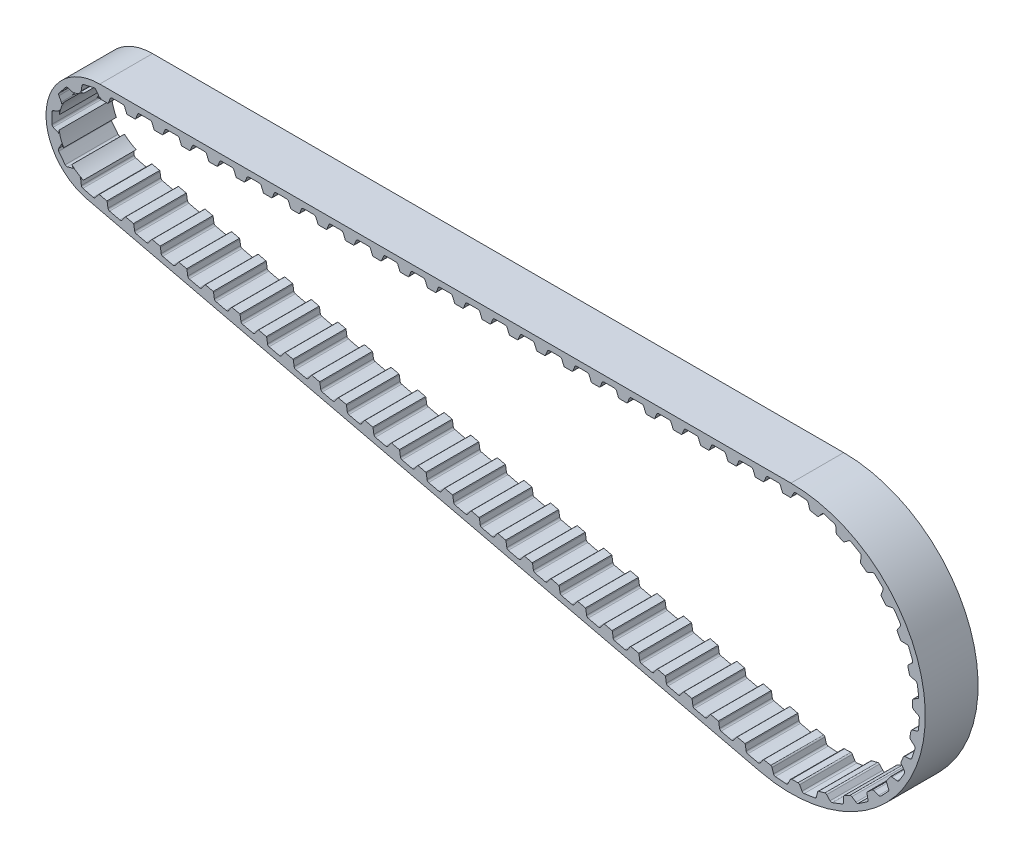
from build123d import *

# Parameters (mm, degrees)
SKETCH1_R           = 54.170022186
SKETCH1_R_2         = 51.884022186
BOSS_EXTRUDE1_DEPTH = 4.7625
CUT_EXTRUDE1_DEPTH  = 4.7625
CIRPATTERN1_COUNT   = 67
BOSS_EXTRUDE2_DEPTH = 4.7625
LPATTERN1_COUNT     = 2
LPATTERN1_PITCH     = 54.229
CRVPATTERN1_START   = -4.7625
CRVPATTERN1_DEPTH   = 9.525


with BuildPart() as part:
    # Sketch1 → Boss-Extrude1 (new, symmetric)
    with BuildSketch(Plane.XY):
        with Locations(Location((0, 0, 0), (0, 0, 180))):
            Circle(SKETCH1_R)
        with Locations(Location((0, 0, 0), (0, 0, 180))):
            Circle(SKETCH1_R_2, mode=Mode.SUBTRACT)
    extrude(amount=BOSS_EXTRUDE1_DEPTH, both=True)

    # Sketch3 → Cut-Extrude1 (cut, symmetric)
    with BuildSketch(Plane.XY):
        with BuildLine():
            Line((-1.980161212, 51.846221847), (1.980161212, 51.846221847))
            ThreePointArc((1.980161212, 51.846221847), (1.776513355, 51.914606858), (1.642231134, 52.082288831))
            Line((1.642231134, 52.082288831), (1.302897103, 52.909118486))
            ThreePointArc((1.302897103, 52.909118486), (1.1654549, 53.0789843), (0.957287799, 53.145401256))
            ThreePointArc((0.957287799, 53.145401256), (0, 53.154022186), (-0.957287799, 53.145401256))
            ThreePointArc((-0.957287799, 53.145401256), (-1.1654549, 53.0789843), (-1.302897103, 52.909118486))
            Line((-1.302897103, 52.909118486), (-1.642231134, 52.082288831))
            ThreePointArc((-1.642231134, 52.082288831), (-1.776513355, 51.914606858), (-1.980161212, 51.846221847))
        make_face()
    cut_extrude1 = extrude(amount=CUT_EXTRUDE1_DEPTH, both=True, mode=Mode.SUBTRACT)

    # CirPattern1: Cut-Extrude1 ×67 about axis
    cirpattern1_axis = Axis((0, 0, 0), (0, 0, 1))
    for i in range(1, CIRPATTERN1_COUNT):
        add(cut_extrude1.rotate(cirpattern1_axis, i * 360 / CIRPATTERN1_COUNT), mode=Mode.SUBTRACT)


with BuildPart() as body_2:
    # Sketch4 → Boss-Extrude2 (new, symmetric)
    with BuildSketch(Plane.XY):
        with BuildLine():
            Line((-62.357, 0), (62.357, 0))
            ThreePointArc((62.357, 0), (86.443630382, -27.060113316), (56.774636225, -47.848722734))
            Line((56.774636225, -47.848722734), (-64.58994551, -19.139489094))
            ThreePointArc((-64.58994551, -19.139489094), (-71.991652153, -8.575954674), (-62.357, 0))
        make_face()
        with BuildLine():
            Line((-62.357, -2.286), (62.357, -2.286))
            ThreePointArc((62.357, -2.286), (84.173030916, -26.795209438), (57.300874724, -45.624117366))
            Line((57.300874724, -45.624117366), (-64.063707011, -16.914883726))
            ThreePointArc((-64.063707011, -16.914883726), (-69.721052687, -8.840858552), (-62.357, -2.286))
        make_face(mode=Mode.SUBTRACT)
    extrude(amount=BOSS_EXTRUDE2_DEPTH, both=True)

    # LPattern1: Cut-Extrude1 ×2
    with Locations(*[(0, -i * LPATTERN1_PITCH, 0) for i in range(1, LPATTERN1_COUNT)]):
        add(cut_extrude1, mode=Mode.SUBTRACT)

    # CrvPattern1: read off the stored shape, not the designer's step
    # CrvPattern1 outline → CrvPattern1 (cut)
    with BuildSketch(Plane.XY.offset(CRVPATTERN1_START)):
        with BuildLine():
            Line((3.189359063, -2.286), (6.670682023, -2.286))
            ThreePointArc((6.670682023, -2.286), (6.613572486, -2.221934244), (6.572251676, -2.146711169))
            Line((6.572251676, -2.146711169), (6.232917645, -1.319881514))
            ThreePointArc((6.232917645, -1.319881514), (6.095475442, -1.1500157), (5.887308341, -1.083598744))
            ThreePointArc((5.887308341, -1.083598744), (4.930020542, -1.074977814), (3.972732744, -1.083598744))
            ThreePointArc((3.972732744, -1.083598744), (3.764565643, -1.1500157), (3.62712344, -1.319881514))
            Line((3.62712344, -1.319881514), (3.287789409, -2.146711169))
            ThreePointArc((3.287789409, -2.146711169), (3.2464686, -2.221934244), (3.189359063, -2.286))
        make_face()
        with BuildLine():
            Line((8.119379606, -2.286), (11.600702565, -2.286))
            ThreePointArc((11.600702565, -2.286), (11.543593029, -2.221934244), (11.502272219, -2.146711169))
            Line((11.502272219, -2.146711169), (11.162938188, -1.319881514))
            ThreePointArc((11.162938188, -1.319881514), (11.025495985, -1.1500157), (10.817328884, -1.083598744))
            ThreePointArc((10.817328884, -1.083598744), (9.860041085, -1.074977814), (8.902753287, -1.083598744))
            ThreePointArc((8.902753287, -1.083598744), (8.694586186, -1.1500157), (8.557143983, -1.319881514))
            Line((8.557143983, -1.319881514), (8.217809952, -2.146711169))
            ThreePointArc((8.217809952, -2.146711169), (8.176489142, -2.221934244), (8.119379606, -2.286))
        make_face()
        with BuildLine():
            Line((13.049400148, -2.286), (16.530723108, -2.286))
            ThreePointArc((16.530723108, -2.286), (16.473613571, -2.221934244), (16.432292762, -2.146711169))
            Line((16.432292762, -2.146711169), (16.092958731, -1.319881514))
            ThreePointArc((16.092958731, -1.319881514), (15.955516528, -1.1500157), (15.747349427, -1.083598744))
            ThreePointArc((15.747349427, -1.083598744), (14.790061629, -1.074977814), (13.83277383, -1.083598744))
            ThreePointArc((13.83277383, -1.083598744), (13.624606729, -1.1500157), (13.487164526, -1.319881514))
            Line((13.487164526, -1.319881514), (13.147830495, -2.146711169))
            ThreePointArc((13.147830495, -2.146711169), (13.106509685, -2.221934244), (13.049400148, -2.286))
        make_face()
        with BuildLine():
            Line((17.979420691, -2.286), (21.460743651, -2.286))
            ThreePointArc((21.460743651, -2.286), (21.403634114, -2.221934244), (21.362313305, -2.146711169))
            Line((21.362313305, -2.146711169), (21.022979274, -1.319881514))
            ThreePointArc((21.022979274, -1.319881514), (20.885537071, -1.1500157), (20.67736997, -1.083598744))
            ThreePointArc((20.67736997, -1.083598744), (19.720082171, -1.074977814), (18.762794372, -1.083598744))
            ThreePointArc((18.762794372, -1.083598744), (18.554627271, -1.1500157), (18.417185068, -1.319881514))
            Line((18.417185068, -1.319881514), (18.077851037, -2.146711169))
            ThreePointArc((18.077851037, -2.146711169), (18.036530228, -2.221934244), (17.979420691, -2.286))
        make_face()
        with BuildLine():
            Line((22.909441234, -2.286), (26.390764194, -2.286))
            ThreePointArc((26.390764194, -2.286), (26.333654657, -2.221934244), (26.292333847, -2.146711169))
            Line((26.292333847, -2.146711169), (25.952999816, -1.319881514))
            ThreePointArc((25.952999816, -1.319881514), (25.815557613, -1.1500157), (25.607390512, -1.083598744))
            ThreePointArc((25.607390512, -1.083598744), (24.650102713, -1.074977814), (23.692814915, -1.083598744))
            ThreePointArc((23.692814915, -1.083598744), (23.484647814, -1.1500157), (23.347205611, -1.319881514))
            Line((23.347205611, -1.319881514), (23.00787158, -2.146711169))
            ThreePointArc((23.00787158, -2.146711169), (22.966550771, -2.221934244), (22.909441234, -2.286))
        make_face()
        with BuildLine():
            Line((27.839461777, -2.286), (31.320784737, -2.286))
            ThreePointArc((31.320784737, -2.286), (31.2636752, -2.221934244), (31.22235439, -2.146711169))
            Line((31.22235439, -2.146711169), (30.883020359, -1.319881514))
            ThreePointArc((30.883020359, -1.319881514), (30.745578156, -1.1500157), (30.537411055, -1.083598744))
            ThreePointArc((30.537411055, -1.083598744), (29.580123256, -1.074977814), (28.622835458, -1.083598744))
            ThreePointArc((28.622835458, -1.083598744), (28.414668357, -1.1500157), (28.277226154, -1.319881514))
            Line((28.277226154, -1.319881514), (27.937892123, -2.146711169))
            ThreePointArc((27.937892123, -2.146711169), (27.896571313, -2.221934244), (27.839461777, -2.286))
        make_face()
        with BuildLine():
            Line((32.769482319, -2.286), (36.250805279, -2.286))
            ThreePointArc((36.250805279, -2.286), (36.193695742, -2.221934244), (36.152374933, -2.146711169))
            Line((36.152374933, -2.146711169), (35.813040902, -1.319881514))
            ThreePointArc((35.813040902, -1.319881514), (35.675598699, -1.1500157), (35.467431598, -1.083598744))
            ThreePointArc((35.467431598, -1.083598744), (34.510143799, -1.074977814), (33.552856001, -1.083598744))
            ThreePointArc((33.552856001, -1.083598744), (33.3446889, -1.1500157), (33.207246697, -1.319881514))
            Line((33.207246697, -1.319881514), (32.867912666, -2.146711169))
            ThreePointArc((32.867912666, -2.146711169), (32.826591856, -2.221934244), (32.769482319, -2.286))
        make_face()
        with BuildLine():
            Line((37.699502862, -2.286), (41.180825822, -2.286))
            ThreePointArc((41.180825822, -2.286), (41.123716285, -2.221934244), (41.082395476, -2.146711169))
            Line((41.082395476, -2.146711169), (40.743061445, -1.319881514))
            ThreePointArc((40.743061445, -1.319881514), (40.605619242, -1.1500157), (40.397452141, -1.083598744))
            ThreePointArc((40.397452141, -1.083598744), (39.440164342, -1.074977814), (38.482876543, -1.083598744))
            ThreePointArc((38.482876543, -1.083598744), (38.274709442, -1.1500157), (38.137267239, -1.319881514))
            Line((38.137267239, -1.319881514), (37.797933208, -2.146711169))
            ThreePointArc((37.797933208, -2.146711169), (37.756612399, -2.221934244), (37.699502862, -2.286))
        make_face()
        with BuildLine():
            Line((42.629523405, -2.286), (46.110846365, -2.286))
            ThreePointArc((46.110846365, -2.286), (46.053736828, -2.221934244), (46.012416019, -2.146711169))
            Line((46.012416019, -2.146711169), (45.673081987, -1.319881514))
            ThreePointArc((45.673081987, -1.319881514), (45.535639784, -1.1500157), (45.327472683, -1.083598744))
            ThreePointArc((45.327472683, -1.083598744), (44.370184884, -1.074977814), (43.412897086, -1.083598744))
            ThreePointArc((43.412897086, -1.083598744), (43.204729985, -1.1500157), (43.067287782, -1.319881514))
            Line((43.067287782, -1.319881514), (42.727953751, -2.146711169))
            ThreePointArc((42.727953751, -2.146711169), (42.686632942, -2.221934244), (42.629523405, -2.286))
        make_face()
        with BuildLine():
            Line((47.559543948, -2.286), (51.040866908, -2.286))
            ThreePointArc((51.040866908, -2.286), (50.983757371, -2.221934244), (50.942436561, -2.146711169))
            Line((50.942436561, -2.146711169), (50.60310253, -1.319881514))
            ThreePointArc((50.60310253, -1.319881514), (50.465660327, -1.1500157), (50.257493226, -1.083598744))
            ThreePointArc((50.257493226, -1.083598744), (49.300205427, -1.074977814), (48.342917629, -1.083598744))
            ThreePointArc((48.342917629, -1.083598744), (48.134750528, -1.1500157), (47.997308325, -1.319881514))
            Line((47.997308325, -1.319881514), (47.657974294, -2.146711169))
            ThreePointArc((47.657974294, -2.146711169), (47.616653484, -2.221934244), (47.559543948, -2.286))
        make_face()
        with BuildLine():
            Line((52.48956449, -2.286), (55.97088745, -2.286))
            ThreePointArc((55.97088745, -2.286), (55.913777913, -2.221934244), (55.872457104, -2.146711169))
            Line((55.872457104, -2.146711169), (55.533123073, -1.319881514))
            ThreePointArc((55.533123073, -1.319881514), (55.39568087, -1.1500157), (55.187513769, -1.083598744))
            ThreePointArc((55.187513769, -1.083598744), (54.230225971, -1.074977814), (53.272938172, -1.083598744))
            ThreePointArc((53.272938172, -1.083598744), (53.064771071, -1.1500157), (52.927328868, -1.319881514))
            Line((52.927328868, -1.319881514), (52.587994837, -2.146711169))
            ThreePointArc((52.587994837, -2.146711169), (52.546674027, -2.221934244), (52.48956449, -2.286))
        make_face()
        with BuildLine():
            Line((57.419585033, -2.286), (60.900907993, -2.286))
            ThreePointArc((60.900907993, -2.286), (60.843798456, -2.221934244), (60.802477647, -2.146711169))
            Line((60.802477647, -2.146711169), (60.463143616, -1.319881514))
            ThreePointArc((60.463143616, -1.319881514), (60.325701413, -1.1500157), (60.117534312, -1.083598744))
            ThreePointArc((60.117534312, -1.083598744), (59.160246513, -1.074977814), (58.202958715, -1.083598744))
            ThreePointArc((58.202958715, -1.083598744), (57.994791613, -1.1500157), (57.85734941, -1.319881514))
            Line((57.85734941, -1.319881514), (57.518015379, -2.146711169))
            ThreePointArc((57.518015379, -2.146711169), (57.47669457, -2.221934244), (57.419585033, -2.286))
        make_face()
        with BuildLine():
            ThreePointArc((62.357, -2.286), (64.165517573, -2.360583375), (65.961752744, -2.583826973))
            ThreePointArc((65.961752744, -2.583826973), (65.822115264, -2.489889515), (65.736569442, -2.344959242))
            Line((65.736569442, -2.344959242), (65.463472184, -1.493952338))
            ThreePointArc((65.463472184, -1.493952338), (65.339848596, -1.313780302), (65.13756512, -1.231159788))
            ThreePointArc((65.13756512, -1.231159788), (64.183936097, -1.147100662), (63.228947862, -1.080229738))
            ThreePointArc((63.228947862, -1.080229738), (63.016192807, -1.130029744), (62.865787455, -1.28853206))
            Line((62.865787455, -1.28853206), (62.46232873, -2.086038123))
            ThreePointArc((62.46232873, -2.086038123), (62.356075269, -2.214941012), (62.204892025, -2.286))
            Line((62.204892025, -2.286), (62.357, -2.286))
        make_face()
        with BuildLine():
            ThreePointArc((67.094885014, -2.803094825), (68.918547345, -3.289003066), (70.693763538, -3.929673484))
            ThreePointArc((70.693763538, -3.929673484), (70.57853743, -3.807012097), (70.527396007, -3.646676741))
            Line((70.527396007, -3.646676741), (70.450565846, -2.756231914))
            ThreePointArc((70.450565846, -2.756231914), (70.370145931, -2.553063532), (70.19132641, -2.42749151))
            ThreePointArc((70.19132641, -2.42749151), (69.280329325, -2.133283146), (68.36418139, -1.85552928))
            ThreePointArc((68.36418139, -1.85552928), (68.145678933, -1.856725206), (67.963767251, -1.977774345))
            Line((67.963767251, -1.977774345), (67.392921252, -2.665473195))
            ThreePointArc((67.392921252, -2.665473195), (67.25948536, -2.768029201), (67.094885014, -2.803094825))
        make_face()
        with BuildLine():
            ThreePointArc((71.749666329, -4.395652485), (73.419428402, -5.275280665), (75.007512801, -6.295005657))
            ThreePointArc((75.007512801, -6.295005657), (74.922479044, -6.149774352), (74.908307822, -5.982078054))
            Line((74.908307822, -5.982078054), (75.031599383, -5.096869574))
            ThreePointArc((75.031599383, -5.096869574), (74.998417867, -4.880897953), (74.852033807, -4.718674463))
            ThreePointArc((74.852033807, -4.718674463), (74.029374051, -4.22907751), (73.198030228, -3.754375817))
            ThreePointArc((73.198030228, -3.754375817), (72.984742797, -3.706907662), (72.780451428, -3.7844305))
            Line((72.780451428, -3.7844305), (72.070857918, -4.327819783))
            ThreePointArc((72.070857918, -4.327819783), (71.91794249, -4.398103093), (71.749666329, -4.395652485))
        make_face()
        with BuildLine():
            ThreePointArc((75.933210696, -6.984317299), (77.365299327, -8.213533826), (78.686576574, -9.561153043))
            ThreePointArc((78.686576574, -9.561153043), (78.636001372, -9.400638182), (78.659511332, -9.233994389))
            Line((78.659511332, -9.233994389), (78.976738988, -8.398433812))
            ThreePointArc((78.976738988, -8.398433812), (78.992460612, -8.180494406), (78.885856208, -7.989758319))
            ThreePointArc((78.885856208, -7.989758319), (78.192807224, -7.329336216), (77.487976642, -6.681502826))
            ThreePointArc((77.487976642, -6.681502826), (77.290605023, -6.587752102), (77.074183414, -6.617859262))
            Line((77.074183414, -6.617859262), (76.261443218, -6.98967674))
            ThreePointArc((76.261443218, -6.98967674), (76.096720134, -7.024161189), (75.933210696, -6.984317299))
        make_face()
        with BuildLine():
            ThreePointArc((79.435626631, -10.439214056), (80.558192883, -11.956348238), (81.546373532, -13.564250637))
            ThreePointArc((81.546373532, -13.564250637), (81.532794282, -13.396505366), (81.592805911, -13.23927472))
            Line((81.592805911, -13.23927472), (82.088054118, -12.495282733))
            ThreePointArc((82.088054118, -12.495282733), (82.151890117, -12.286309722), (82.090413791, -12.076630407))
            ThreePointArc((82.090413791, -12.076630407), (81.561746352, -11.278517014), (81.018790878, -10.490054204))
            ThreePointArc((81.018790878, -10.490054204), (80.84723735, -10.354724454), (80.629543532, -10.335905437))
            Line((80.629543532, -10.335905437), (79.754432421, -10.517496754))
            ThreePointArc((79.754432421, -10.517496754), (79.586165958, -10.514452231), (79.435626631, -10.439214056))
        make_face()
        with BuildLine():
            ThreePointArc((82.081195363, -14.587008057), (82.837919266, -16.315944161), (83.443425569, -18.103460101))
            ThreePointArc((83.443425569, -18.103460101), (83.467523551, -17.936900325), (83.561026023, -17.796971202))
            Line((83.561026023, -17.796971202), (84.209447816, -17.181874427))
            ThreePointArc((84.209447816, -17.181874427), (84.31819549, -16.99235214), (84.304931553, -16.774249362))
            ThreePointArc((84.304931553, -16.774249362), (83.967169294, -15.878486611), (83.6133294, -14.988952138))
            ThreePointArc((83.6133294, -14.988952138), (83.47620093, -14.818832954), (83.268156761, -14.752031924))
            Line((83.268156761, -14.752031924), (82.3745797, -14.734286512))
            ThreePointArc((82.3745797, -14.734286512), (82.21121191, -14.693865764), (82.081195363, -14.587008057))
        make_face()
        with BuildLine():
            ThreePointArc((83.73718677, -19.21960144), (84.090102931, -21.073597476), (84.282556195, -22.951045973))
            ThreePointArc((84.282556195, -22.951045973), (84.343122395, -22.794028117), (84.465424622, -22.678420863))
            Line((84.465424622, -22.678420863), (85.234488204, -22.223079157))
            ThreePointArc((85.234488204, -22.223079157), (85.382691604, -22.062516066), (85.418305519, -21.8469322))
            ThreePointArc((85.418305519, -21.8469322), (85.288394218, -20.898461165), (85.141422312, -19.952483624))
            ThreePointArc((85.141422312, -19.952483624), (85.045598735, -19.75611001), (84.857641943, -19.644678425))
            Line((84.857641943, -19.644678425), (83.990430348, -19.428486583))
            ThreePointArc((83.990430348, -19.428486583), (83.840157512, -19.352717548), (83.73718677, -19.21960144))
        make_face()
        with BuildLine():
            ThreePointArc((84.320518552, -24.104573602), (84.251920909, -25.990613231), (84.021665611, -27.863801319))
            ThreePointArc((84.021665611, -27.863801319), (84.11566138, -27.724203084), (84.260627369, -27.6387178))
            Line((84.260627369, -27.6387178), (85.111748258, -27.365975989))
            ThreePointArc((85.111748258, -27.365975989), (85.291971909, -27.242427661), (85.374676899, -27.040178709))
            ThreePointArc((85.374676899, -27.040178709), (85.459134302, -26.086584877), (85.526404072, -25.131624654))
            ThreePointArc((85.526404072, -25.131624654), (85.476692927, -24.918848819), (85.318253442, -24.768377281))
            Line((85.318253442, -24.768377281), (84.520915954, -24.364585512))
            ThreePointArc((84.520915954, -24.364585512), (84.391277371, -24.257269579), (84.320518552, -24.104573602))
        make_face()
        with BuildLine():
            ThreePointArc((83.801924525, -28.996841913), (83.315254671, -30.820301145), (82.67384289, -32.595249607))
            ThreePointArc((82.67384289, -32.595249607), (82.79655239, -32.480074739), (82.956909092, -32.429000284))
            Line((82.956909092, -32.429000284), (83.847385929, -32.352542025))
            ThreePointArc((83.847385929, -32.352542025), (84.05058788, -32.27220697), (84.176234576, -32.09343991))
            ThreePointArc((84.176234576, -32.09343991), (84.470823392, -31.182565781), (84.748959864, -30.266533929))
            ThreePointArc((84.748959864, -30.266533929), (84.747855196, -30.048030992), (84.626882043, -29.86606877))
            Line((84.626882043, -29.86606877), (83.939421667, -29.294935603))
            ThreePointArc((83.939421667, -29.294935603), (83.836921399, -29.16145689), (83.801924525, -28.996841913))
        make_face()
        with BuildLine():
            ThreePointArc((82.207422931, -33.650957689), (81.327097451, -35.32035224), (80.306709283, -36.908010612))
            ThreePointArc((80.306709283, -36.908010612), (80.451976089, -36.823037517), (80.619678291, -36.808936335))
            Line((80.619678291, -36.808936335), (81.504835202, -36.932597594))
            ThreePointArc((81.504835202, -36.932597594), (81.720820662, -36.899506281), (81.883105276, -36.753189986))
            ThreePointArc((81.883105276, -36.753189986), (82.37304577, -35.930734783), (82.848094633, -35.099589292))
            ThreePointArc((82.848094633, -35.099589292), (82.895651864, -34.886321705), (82.818214355, -34.681997976))
            Line((82.818214355, -34.681997976), (82.275121481, -33.97217758))
            ThreePointArc((82.275121481, -33.97217758), (82.204902043, -33.819232811), (82.207422931, -33.650957689))
        make_face()
        with BuildLine():
            ThreePointArc((79.617011083, -37.833420534), (78.38719655, -39.264995657), (77.039025619, -40.585709955))
            ThreePointArc((77.039025619, -40.585709955), (77.199561589, -40.535201797), (77.366195548, -40.558781353))
            Line((77.366195548, -40.558781353), (78.201623562, -40.876357954))
            ThreePointArc((78.201623562, -40.876357954), (78.419556382, -40.892170599), (78.610336976, -40.785645866))
            ThreePointArc((78.610336976, -40.785645866), (79.271048475, -40.092872768), (79.91917618, -39.388312815))
            ThreePointArc((79.91917618, -39.388312815), (80.013009328, -39.190980369), (79.98299256, -38.974546204))
            Line((79.98299256, -38.974546204), (79.611514556, -38.161650789))
            ThreePointArc((79.611514556, -38.161650789), (79.577098907, -37.996913317), (79.617011083, -37.833420534))
        make_face()
        with BuildLine():
            ThreePointArc((76.160651841, -41.334393225), (74.64304895, -42.456325747), (73.034733978, -43.443834768))
            ThreePointArc((73.034733978, -43.443834768), (73.202484905, -43.430325578), (73.359690474, -43.490402869))
            Line((73.359690474, -43.490402869), (74.103475555, -43.985961762))
            ThreePointArc((74.103475555, -43.985961762), (74.312421886, -44.049885032), (74.522126859, -43.988496284))
            ThreePointArc((74.522126859, -43.988496284), (75.320460982, -43.460162225), (76.109150488, -42.917536099))
            ThreePointArc((76.109150488, -42.917536099), (76.244551876, -42.746039108), (76.263461811, -42.528353168))
            Line((76.263461811, -42.528353168), (76.082236001, -41.653166292))
            ThreePointArc((76.082236001, -41.653166292), (76.0853508, -41.484901115), (76.160651841, -41.334393225))
        make_face()
        with BuildLine():
            ThreePointArc((72.011753278, -43.978229397), (70.282501278, -44.734231142), (68.494732605, -45.338990836))
            ThreePointArc((68.494732605, -45.338990836), (68.661282302, -45.36315838), (68.801172362, -45.456719285))
            Line((68.801172362, -45.456719285), (69.415998269, -46.105397916))
            ThreePointArc((69.415998269, -46.105397916), (69.605475121, -46.214224735), (69.82358342, -46.201051891))
            ThreePointArc((69.82358342, -46.201051891), (70.719487159, -45.863663776), (71.609169337, -45.510195428))
            ThreePointArc((71.609169337, -45.510195428), (71.779345777, -45.37313802), (71.846233691, -45.165121769))
            Line((71.846233691, -45.165121769), (71.864352305, -44.271552197))
            ThreePointArc((71.864352305, -44.271552197), (71.90484128, -44.108201303), (72.011753278, -43.978229397))
        make_face()
        with BuildLine():
            ThreePointArc((67.378468674, -45.632285854), (65.524325404, -45.984427661), (63.646796693, -46.176096791))
            ThreePointArc((63.646796693, -46.176096791), (63.80378924, -46.236728565), (63.919345404, -46.359079065))
            Line((63.919345404, -46.359079065), (64.37436587, -47.128332754))
            ThreePointArc((64.37436587, -47.128332754), (64.534867051, -47.276603199), (64.750436023, -47.31230715))
            ThreePointArc((64.750436023, -47.31230715), (65.698961232, -47.18279199), (66.645000074, -47.036215185))
            ThreePointArc((66.645000074, -47.036215185), (66.841413691, -46.940473632), (66.952923767, -46.752563395))
            Line((66.952923767, -46.752563395), (67.169477782, -45.885442169))
            ThreePointArc((67.169477782, -45.885442169), (67.245309572, -45.735200991), (67.378468674, -45.632285854))
        make_face()
        with BuildLine():
            ThreePointArc((62.493253309, -46.213577373), (60.607242495, -46.14419203), (58.734150736, -45.913154415))
            ThreePointArc((58.734150736, -45.913154415), (58.873709701, -46.007208479), (58.959134433, -46.152210159))
            Line((58.959134433, -46.152210159), (59.231520749, -47.003444884))
            ThreePointArc((59.231520749, -47.003444884), (59.354993796, -47.18372012), (59.557208188, -47.266509572))
            ThreePointArc((59.557208188, -47.266509572), (60.510766663, -47.351365237), (61.465698708, -47.41903384))
            ThreePointArc((61.465698708, -47.41903384), (61.678495287, -47.369411566), (61.829032983, -47.211034939))
            Line((61.829032983, -47.211034939), (62.233157725, -46.413866164))
            ThreePointArc((62.233157725, -46.413866164), (62.340527793, -46.284272413), (62.493253309, -46.213577373))
        make_face()
        with BuildLine():
            Line((57.300874724, -45.624117366), (54.069635753, -44.859756025))
            ThreePointArc((54.069635753, -44.859756025), (54.110463538, -44.935247828), (54.133358208, -45.017962726))
            Line((54.133358208, -45.017962726), (54.273242159, -45.900701273))
            ThreePointArc((54.273242159, -45.900701273), (54.367889898, -46.097644309), (54.555177077, -46.210197703))
            ThreePointArc((54.555177077, -46.210197703), (55.484770651, -46.438955298), (56.418333311, -46.650934093))
            ThreePointArc((56.418333311, -46.650934093), (56.636198932, -46.634221069), (56.809053084, -46.500556579))
            Line((56.809053084, -46.500556579), (57.329610347, -45.774047805))
            ThreePointArc((57.329610347, -45.774047805), (57.387472485, -45.710061891), (57.458246293, -45.660733479))
            ThreePointArc((57.458246293, -45.660733479), (57.379526838, -45.642570133), (57.300874724, -45.624117366))
        make_face()
        with BuildLine():
            Line((52.659845544, -44.526265018), (49.272019759, -43.724862495))
            ThreePointArc((49.272019759, -43.724862495), (49.312847543, -43.800354298), (49.335742214, -43.883069196))
            Line((49.335742214, -43.883069196), (49.475626164, -44.765807744))
            ThreePointArc((49.475626164, -44.765807744), (49.570273903, -44.96275078), (49.757561082, -45.075304174))
            ThreePointArc((49.757561082, -45.075304174), (50.687154656, -45.304061769), (51.620717316, -45.516040564))
            ThreePointArc((51.620717316, -45.516040564), (51.838582937, -45.49932754), (52.01143709, -45.36566305))
            Line((52.01143709, -45.36566305), (52.531994353, -44.639154276))
            ThreePointArc((52.531994353, -44.639154276), (52.589521813, -44.575463525), (52.659845544, -44.526265018))
        make_face()
        with BuildLine():
            Line((47.86222955, -43.391371489), (44.474403765, -42.589968966))
            ThreePointArc((44.474403765, -42.589968966), (44.515231549, -42.665460769), (44.538126219, -42.748175667))
            Line((44.538126219, -42.748175667), (44.67801017, -43.630914215))
            ThreePointArc((44.67801017, -43.630914215), (44.772657909, -43.827857251), (44.959945088, -43.940410645))
            ThreePointArc((44.959945088, -43.940410645), (45.889538662, -44.16916824), (46.823101322, -44.381147035))
            ThreePointArc((46.823101322, -44.381147035), (47.040966943, -44.36443401), (47.213821096, -44.230769521))
            Line((47.213821096, -44.230769521), (47.734378359, -43.504260747))
            ThreePointArc((47.734378359, -43.504260747), (47.791905818, -43.440569996), (47.86222955, -43.391371489))
        make_face()
        with BuildLine():
            Line((43.064613555, -42.256477959), (39.67678777, -41.455075437))
            ThreePointArc((39.67678777, -41.455075437), (39.717615555, -41.53056724), (39.740510225, -41.613282138))
            Line((39.740510225, -41.613282138), (39.880394176, -42.496020685))
            ThreePointArc((39.880394176, -42.496020685), (39.975041915, -42.692963721), (40.162329094, -42.805517115))
            ThreePointArc((40.162329094, -42.805517115), (41.091922668, -43.03427471), (42.025485328, -43.246253505))
            ThreePointArc((42.025485328, -43.246253505), (42.243350949, -43.229540481), (42.416205101, -43.095875991))
            Line((42.416205101, -43.095875991), (42.936762364, -42.369367217))
            ThreePointArc((42.936762364, -42.369367217), (42.994289824, -42.305676467), (43.064613555, -42.256477959))
        make_face()
        with BuildLine():
            Line((38.266997561, -41.12158443), (34.879171776, -40.320181907))
            ThreePointArc((34.879171776, -40.320181907), (34.91999956, -40.39567371), (34.942894231, -40.478388608))
            Line((34.942894231, -40.478388608), (35.082778181, -41.361127156))
            ThreePointArc((35.082778181, -41.361127156), (35.17742592, -41.558070192), (35.364713099, -41.670623586))
            ThreePointArc((35.364713099, -41.670623586), (36.294306673, -41.899381181), (37.227869333, -42.111359976))
            ThreePointArc((37.227869333, -42.111359976), (37.445734954, -42.094646952), (37.618589107, -41.960982462))
            Line((37.618589107, -41.960982462), (38.13914637, -41.234473688))
            ThreePointArc((38.13914637, -41.234473688), (38.19667383, -41.170782937), (38.266997561, -41.12158443))
        make_face()
        with BuildLine():
            Line((33.469381567, -39.986690901), (30.081555782, -39.185288378))
            ThreePointArc((30.081555782, -39.185288378), (30.122383566, -39.260780181), (30.145278236, -39.343495079))
            Line((30.145278236, -39.343495079), (30.285162187, -40.226233627))
            ThreePointArc((30.285162187, -40.226233627), (30.379809926, -40.423176663), (30.567097105, -40.535730057))
            ThreePointArc((30.567097105, -40.535730057), (31.496690679, -40.764487652), (32.430253339, -40.976466447))
            ThreePointArc((32.430253339, -40.976466447), (32.64811896, -40.959753423), (32.820973113, -40.826088933))
            Line((32.820973113, -40.826088933), (33.341530376, -40.099580159))
            ThreePointArc((33.341530376, -40.099580159), (33.399057835, -40.035889408), (33.469381567, -39.986690901))
        make_face()
        with BuildLine():
            Line((28.671765572, -38.851797371), (25.283939787, -38.050394849))
            ThreePointArc((25.283939787, -38.050394849), (25.324767572, -38.125886652), (25.347662242, -38.20860155))
            Line((25.347662242, -38.20860155), (25.487546193, -39.091340097))
            ThreePointArc((25.487546193, -39.091340097), (25.582193932, -39.288283133), (25.769481111, -39.400836528))
            ThreePointArc((25.769481111, -39.400836528), (26.699074685, -39.629594122), (27.632637345, -39.841572917))
            ThreePointArc((27.632637345, -39.841572917), (27.850502965, -39.824859893), (28.023357118, -39.691195404))
            Line((28.023357118, -39.691195404), (28.543914381, -38.964686629))
            ThreePointArc((28.543914381, -38.964686629), (28.601441841, -38.900995879), (28.671765572, -38.851797371))
        make_face()
        with BuildLine():
            Line((23.874149578, -37.716903842), (20.486323793, -36.915501319))
            ThreePointArc((20.486323793, -36.915501319), (20.527151577, -36.990993122), (20.550046248, -37.07370802))
            Line((20.550046248, -37.07370802), (20.689930198, -37.956446568))
            ThreePointArc((20.689930198, -37.956446568), (20.784577937, -38.153389604), (20.971865116, -38.265942998))
            ThreePointArc((20.971865116, -38.265942998), (21.90145869, -38.494700593), (22.83502135, -38.706679388))
            ThreePointArc((22.83502135, -38.706679388), (23.052886971, -38.689966364), (23.225741124, -38.556301874))
            Line((23.225741124, -38.556301874), (23.746298387, -37.8297931))
            ThreePointArc((23.746298387, -37.8297931), (23.803825847, -37.766102349), (23.874149578, -37.716903842))
        make_face()
        with BuildLine():
            Line((19.076533583, -36.582010313), (15.688707799, -35.78060779))
            ThreePointArc((15.688707799, -35.78060779), (15.729535583, -35.856099593), (15.752430253, -35.938814491))
            Line((15.752430253, -35.938814491), (15.892314204, -36.821553039))
            ThreePointArc((15.892314204, -36.821553039), (15.986961943, -37.018496075), (16.174249122, -37.131049469))
            ThreePointArc((16.174249122, -37.131049469), (17.103842696, -37.359807064), (18.037405356, -37.571785859))
            ThreePointArc((18.037405356, -37.571785859), (18.255270977, -37.555072835), (18.42812513, -37.421408345))
            Line((18.42812513, -37.421408345), (18.948682393, -36.694899571))
            ThreePointArc((18.948682393, -36.694899571), (19.006209852, -36.63120882), (19.076533583, -36.582010313))
        make_face()
        with BuildLine():
            Line((14.278917589, -35.447116784), (10.891091804, -34.645714261))
            ThreePointArc((10.891091804, -34.645714261), (10.931919589, -34.721206064), (10.954814259, -34.803920962))
            Line((10.954814259, -34.803920962), (11.09469821, -35.686659509))
            ThreePointArc((11.09469821, -35.686659509), (11.189345949, -35.883602545), (11.376633128, -35.99615594))
            ThreePointArc((11.376633128, -35.99615594), (12.306226702, -36.224913534), (13.239789362, -36.43689233))
            ThreePointArc((13.239789362, -36.43689233), (13.457654982, -36.420179305), (13.630509135, -36.286514816))
            Line((13.630509135, -36.286514816), (14.151066398, -35.560006041))
            ThreePointArc((14.151066398, -35.560006041), (14.208593858, -35.496315291), (14.278917589, -35.447116784))
        make_face()
        with BuildLine():
            Line((9.481301595, -34.312223254), (6.09347581, -33.510820731))
            ThreePointArc((6.09347581, -33.510820731), (6.134303594, -33.586312534), (6.157198265, -33.669027432))
            Line((6.157198265, -33.669027432), (6.297082215, -34.55176598))
            ThreePointArc((6.297082215, -34.55176598), (6.391729954, -34.748709016), (6.579017133, -34.86126241))
            ThreePointArc((6.579017133, -34.86126241), (7.508610707, -35.090020005), (8.442173367, -35.3019988))
            ThreePointArc((8.442173367, -35.3019988), (8.660038988, -35.285285776), (8.832893141, -35.151621286))
            Line((8.832893141, -35.151621286), (9.353450404, -34.425112512))
            ThreePointArc((9.353450404, -34.425112512), (9.410977864, -34.361421762), (9.481301595, -34.312223254))
        make_face()
        with BuildLine():
            Line((4.6836856, -33.177329725), (1.295859816, -32.375927202))
            ThreePointArc((1.295859816, -32.375927202), (1.3366876, -32.451419005), (1.35958227, -32.534133903))
            Line((1.35958227, -32.534133903), (1.499466221, -33.416872451))
            ThreePointArc((1.499466221, -33.416872451), (1.59411396, -33.613815487), (1.781401139, -33.726368881))
            ThreePointArc((1.781401139, -33.726368881), (2.710994713, -33.955126476), (3.644557373, -34.167105271))
            ThreePointArc((3.644557373, -34.167105271), (3.862422994, -34.150392247), (4.035277147, -34.016727757))
            Line((4.035277147, -34.016727757), (4.55583441, -33.290218983))
            ThreePointArc((4.55583441, -33.290218983), (4.613361869, -33.226528232), (4.6836856, -33.177329725))
        make_face()
        with BuildLine():
            Line((-0.113930394, -32.042436196), (-3.501756179, -31.241033673))
            ThreePointArc((-3.501756179, -31.241033673), (-3.460928394, -31.316525476), (-3.438033724, -31.399240374))
            Line((-3.438033724, -31.399240374), (-3.298149773, -32.281978921))
            ThreePointArc((-3.298149773, -32.281978921), (-3.203502034, -32.478921958), (-3.016214855, -32.591475352))
            ThreePointArc((-3.016214855, -32.591475352), (-2.086621281, -32.820232946), (-1.153058621, -33.032211742))
            ThreePointArc((-1.153058621, -33.032211742), (-0.935193001, -33.015498717), (-0.762338848, -32.881834228))
            Line((-0.762338848, -32.881834228), (-0.241781585, -32.155325453))
            ThreePointArc((-0.241781585, -32.155325453), (-0.184254125, -32.091634703), (-0.113930394, -32.042436196))
        make_face()
        with BuildLine():
            Line((-4.911546388, -30.907542666), (-8.299372173, -30.106140143))
            ThreePointArc((-8.299372173, -30.106140143), (-8.258544389, -30.181631947), (-8.235649718, -30.264346845))
            Line((-8.235649718, -30.264346845), (-8.095765768, -31.147085392))
            ThreePointArc((-8.095765768, -31.147085392), (-8.001118029, -31.344028428), (-7.81383085, -31.456581822))
            ThreePointArc((-7.81383085, -31.456581822), (-6.884237276, -31.685339417), (-5.950674616, -31.897318212))
            ThreePointArc((-5.950674616, -31.897318212), (-5.732808995, -31.880605188), (-5.559954842, -31.746940698))
            Line((-5.559954842, -31.746940698), (-5.039397579, -31.020431924))
            ThreePointArc((-5.039397579, -31.020431924), (-4.981870119, -30.956741174), (-4.911546388, -30.907542666))
        make_face()
        with BuildLine():
            Line((-9.709162383, -29.772649137), (-13.096988167, -28.971246614))
            ThreePointArc((-13.096988167, -28.971246614), (-13.056160383, -29.046738417), (-13.033265713, -29.129453315))
            Line((-13.033265713, -29.129453315), (-12.893381762, -30.012191863))
            ThreePointArc((-12.893381762, -30.012191863), (-12.798734023, -30.209134899), (-12.611446844, -30.321688293))
            ThreePointArc((-12.611446844, -30.321688293), (-11.68185327, -30.550445888), (-10.74829061, -30.762424683))
            ThreePointArc((-10.74829061, -30.762424683), (-10.530424989, -30.745711659), (-10.357570836, -30.612047169))
            Line((-10.357570836, -30.612047169), (-9.837013573, -29.885538395))
            ThreePointArc((-9.837013573, -29.885538395), (-9.779486114, -29.821847644), (-9.709162383, -29.772649137))
        make_face()
        with BuildLine():
            Line((-14.506778377, -28.637755608), (-17.894604162, -27.836353085))
            ThreePointArc((-17.894604162, -27.836353085), (-17.853776377, -27.911844888), (-17.830881707, -27.994559786))
            Line((-17.830881707, -27.994559786), (-17.690997756, -28.877298334))
            ThreePointArc((-17.690997756, -28.877298334), (-17.596350017, -29.07424137), (-17.409062838, -29.186794764))
            ThreePointArc((-17.409062838, -29.186794764), (-16.479469264, -29.415552359), (-15.545906604, -29.627531154))
            ThreePointArc((-15.545906604, -29.627531154), (-15.328040984, -29.610818129), (-15.155186831, -29.47715364))
            Line((-15.155186831, -29.47715364), (-14.634629568, -28.750644866))
            ThreePointArc((-14.634629568, -28.750644866), (-14.577102108, -28.686954115), (-14.506778377, -28.637755608))
        make_face()
        with BuildLine():
            Line((-19.304394371, -27.502862078), (-22.692220156, -26.701459556))
            ThreePointArc((-22.692220156, -26.701459556), (-22.651392372, -26.776951359), (-22.628497701, -26.859666257))
            Line((-22.628497701, -26.859666257), (-22.488613751, -27.742404804))
            ThreePointArc((-22.488613751, -27.742404804), (-22.393966012, -27.93934784), (-22.206678833, -28.051901234))
            ThreePointArc((-22.206678833, -28.051901234), (-21.277085259, -28.280658829), (-20.343522599, -28.492637624))
            ThreePointArc((-20.343522599, -28.492637624), (-20.125656978, -28.4759246), (-19.952802825, -28.34226011))
            Line((-19.952802825, -28.34226011), (-19.432245562, -27.615751336))
            ThreePointArc((-19.432245562, -27.615751336), (-19.374718102, -27.552060586), (-19.304394371, -27.502862078))
        make_face()
        with BuildLine():
            Line((-24.102010366, -26.367968549), (-27.48983615, -25.566566026))
            ThreePointArc((-27.48983615, -25.566566026), (-27.449008366, -25.642057829), (-27.426113696, -25.724772727))
            Line((-27.426113696, -25.724772727), (-27.286229745, -26.607511275))
            ThreePointArc((-27.286229745, -26.607511275), (-27.191582006, -26.804454311), (-27.004294827, -26.917007705))
            ThreePointArc((-27.004294827, -26.917007705), (-26.074701253, -27.1457653), (-25.141138593, -27.357744095))
            ThreePointArc((-25.141138593, -27.357744095), (-24.923272972, -27.341031071), (-24.750418819, -27.207366581))
            Line((-24.750418819, -27.207366581), (-24.229861556, -26.480857807))
            ThreePointArc((-24.229861556, -26.480857807), (-24.172334097, -26.417167056), (-24.102010366, -26.367968549))
        make_face()
        with BuildLine():
            Line((-28.89962636, -25.23307502), (-32.287452145, -24.431672497))
            ThreePointArc((-32.287452145, -24.431672497), (-32.24662436, -24.5071643), (-32.22372969, -24.589879198))
            Line((-32.22372969, -24.589879198), (-32.083845739, -25.472617746))
            ThreePointArc((-32.083845739, -25.472617746), (-31.989198, -25.669560782), (-31.801910821, -25.782114176))
            ThreePointArc((-31.801910821, -25.782114176), (-30.872317247, -26.010871771), (-29.938754587, -26.222850566))
            ThreePointArc((-29.938754587, -26.222850566), (-29.720888967, -26.206137541), (-29.548034814, -26.072473052))
            Line((-29.548034814, -26.072473052), (-29.027477551, -25.345964278))
            ThreePointArc((-29.027477551, -25.345964278), (-28.969950091, -25.282273527), (-28.89962636, -25.23307502))
        make_face()
        with BuildLine():
            Line((-33.697242354, -24.09818149), (-37.085068139, -23.296778968))
            ThreePointArc((-37.085068139, -23.296778968), (-37.044240355, -23.372270771), (-37.021345684, -23.454985669))
            Line((-37.021345684, -23.454985669), (-36.881461734, -24.337724216))
            ThreePointArc((-36.881461734, -24.337724216), (-36.786813995, -24.534667252), (-36.599526816, -24.647220646))
            ThreePointArc((-36.599526816, -24.647220646), (-35.669933242, -24.875978241), (-34.736370582, -25.087957036))
            ThreePointArc((-34.736370582, -25.087957036), (-34.518504961, -25.071244012), (-34.345650808, -24.937579522))
            Line((-34.345650808, -24.937579522), (-33.825093545, -24.211070748))
            ThreePointArc((-33.825093545, -24.211070748), (-33.767566085, -24.147379998), (-33.697242354, -24.09818149))
        make_face()
        with BuildLine():
            Line((-38.494858349, -22.963287961), (-41.882684133, -22.161885438))
            ThreePointArc((-41.882684133, -22.161885438), (-41.841856349, -22.237377241), (-41.818961679, -22.320092139))
            Line((-41.818961679, -22.320092139), (-41.679077728, -23.202830687))
            ThreePointArc((-41.679077728, -23.202830687), (-41.584429989, -23.399773723), (-41.39714281, -23.512327117))
            ThreePointArc((-41.39714281, -23.512327117), (-40.467549236, -23.741084712), (-39.533986576, -23.953063507))
            ThreePointArc((-39.533986576, -23.953063507), (-39.316120955, -23.936350483), (-39.143266802, -23.802685993))
            Line((-39.143266802, -23.802685993), (-38.622709539, -23.076177219))
            ThreePointArc((-38.622709539, -23.076177219), (-38.56518208, -23.012486468), (-38.494858349, -22.963287961))
        make_face()
        with BuildLine():
            Line((-43.292474343, -21.828394432), (-46.680300128, -21.026991909))
            ThreePointArc((-46.680300128, -21.026991909), (-46.639472343, -21.102483712), (-46.616577673, -21.18519861))
            Line((-46.616577673, -21.18519861), (-46.476693722, -22.067937158))
            ThreePointArc((-46.476693722, -22.067937158), (-46.382045983, -22.264880194), (-46.194758804, -22.377433588))
            ThreePointArc((-46.194758804, -22.377433588), (-45.26516523, -22.606191183), (-44.33160257, -22.818169978))
            ThreePointArc((-44.33160257, -22.818169978), (-44.113736949, -22.801456954), (-43.940882797, -22.667792464))
            Line((-43.940882797, -22.667792464), (-43.420325534, -21.94128369))
            ThreePointArc((-43.420325534, -21.94128369), (-43.362798074, -21.877592939), (-43.292474343, -21.828394432))
        make_face()
        with BuildLine():
            Line((-48.090090337, -20.693500903), (-51.477916122, -19.89209838))
            ThreePointArc((-51.477916122, -19.89209838), (-51.437088338, -19.967590183), (-51.414193667, -20.050305081))
            Line((-51.414193667, -20.050305081), (-51.274309717, -20.933043628))
            ThreePointArc((-51.274309717, -20.933043628), (-51.179661978, -21.129986664), (-50.992374799, -21.242540059))
            ThreePointArc((-50.992374799, -21.242540059), (-50.062781225, -21.471297653), (-49.129218565, -21.683276449))
            ThreePointArc((-49.129218565, -21.683276449), (-48.911352944, -21.666563424), (-48.738498791, -21.532898935))
            Line((-48.738498791, -21.532898935), (-48.217941528, -20.80639016))
            ThreePointArc((-48.217941528, -20.80639016), (-48.160414068, -20.74269941), (-48.090090337, -20.693500903))
        make_face()
        with BuildLine():
            Line((-52.887706332, -19.558607373), (-56.275532116, -18.75720485))
            ThreePointArc((-56.275532116, -18.75720485), (-56.234704332, -18.832696653), (-56.211809662, -18.915411551))
            Line((-56.211809662, -18.915411551), (-56.071925711, -19.798150099))
            ThreePointArc((-56.071925711, -19.798150099), (-55.977277972, -19.995093135), (-55.789990793, -20.107646529))
            ThreePointArc((-55.789990793, -20.107646529), (-54.860397219, -20.336404124), (-53.926834559, -20.548382919))
            ThreePointArc((-53.926834559, -20.548382919), (-53.708968938, -20.531669895), (-53.536114785, -20.398005405))
            Line((-53.536114785, -20.398005405), (-53.015557522, -19.671496631))
            ThreePointArc((-53.015557522, -19.671496631), (-52.958030063, -19.60780588), (-52.887706332, -19.558607373))
        make_face()
        with BuildLine():
            Line((-57.685322326, -18.423713844), (-61.073148111, -17.622311321))
            ThreePointArc((-61.073148111, -17.622311321), (-61.032320326, -17.697803124), (-61.009425656, -17.780518022))
            Line((-61.009425656, -17.780518022), (-60.869541705, -18.66325657))
            ThreePointArc((-60.869541705, -18.66325657), (-60.774893966, -18.860199606), (-60.587606787, -18.972753))
            ThreePointArc((-60.587606787, -18.972753), (-59.658013213, -19.201510595), (-58.724450553, -19.41348939))
            ThreePointArc((-58.724450553, -19.41348939), (-58.506584932, -19.396776366), (-58.33373078, -19.263111876))
            Line((-58.33373078, -19.263111876), (-57.813173517, -18.536603102))
            ThreePointArc((-57.813173517, -18.536603102), (-57.755646057, -18.472912351), (-57.685322326, -18.423713844))
        make_face()
        with BuildLine():
            ThreePointArc((-64.063707011, -16.914883726), (-64.696240292, -16.735293232), (-65.310374064, -16.500365993))
            Line((-65.310374064, -16.500365993), (-66.072479572, -16.307418976))
            ThreePointArc((-66.072479572, -16.307418976), (-65.89184446, -16.423694148), (-65.802824048, -16.619204571))
            Line((-65.802824048, -16.619204571), (-65.676799884, -17.504028154))
            ThreePointArc((-65.676799884, -17.504028154), (-65.585252128, -17.702431184), (-65.399752974, -17.817907666))
            ThreePointArc((-65.399752974, -17.817907666), (-64.473860946, -18.061214472), (-63.543737205, -18.287806783))
            ThreePointArc((-63.543737205, -18.287806783), (-63.325636289, -18.274512254), (-63.150707342, -18.143574797))
            Line((-63.150707342, -18.143574797), (-62.618821404, -17.425318428))
            ThreePointArc((-62.618821404, -17.425318428), (-62.543501237, -17.348970647), (-62.449887888, -17.296638515))
            Line((-62.449887888, -17.296638515), (-64.063707011, -16.914883726))
        make_face()
        with BuildLine():
            ThreePointArc((-67.417036674, -15.118802899), (-68.223673459, -14.233159883), (-68.877149785, -13.229170269))
            Line((-68.877149785, -13.229170269), (-69.35782797, -12.607091625))
            ThreePointArc((-69.35782797, -12.607091625), (-69.287423901, -12.810050306), (-69.338005585, -13.018833573))
            Line((-69.338005585, -13.018833573), (-69.784793307, -13.792897907))
            ThreePointArc((-69.784793307, -13.792897907), (-69.835170942, -14.005516928), (-69.760446345, -14.21084834))
            ThreePointArc((-69.760446345, -14.21084834), (-69.181951273, -14.973618097), (-68.589812775, -15.725845621))
            ThreePointArc((-68.589812775, -15.725845621), (-68.409977147, -15.849958074), (-68.191526278, -15.854854166))
            Line((-68.191526278, -15.854854166), (-67.329778907, -15.617817605))
            ThreePointArc((-67.329778907, -15.617817605), (-67.114988219, -15.621548485), (-66.936358489, -15.740881543))
            Line((-66.936358489, -15.740881543), (-67.417036674, -15.118802899))
        make_face()
        with BuildLine():
            ThreePointArc((-69.682505026, -10.842091118), (-69.770813582, -9.647424615), (-69.665570699, -8.454130691))
            Line((-69.665570699, -8.454130691), (-69.659995815, -7.667999482))
            ThreePointArc((-69.659995815, -7.667999482), (-69.729823248, -7.871157275), (-69.898453249, -8.004247026))
            Line((-69.898453249, -8.004247026), (-70.727668456, -8.337709173))
            ThreePointArc((-70.727668456, -8.337709173), (-70.898504652, -8.47394334), (-70.966396127, -8.68163422))
            ThreePointArc((-70.966396127, -8.68163422), (-70.981805318, -9.638836814), (-70.979973082, -10.596161677))
            ThreePointArc((-70.979973082, -10.596161677), (-70.915033986, -10.80479453), (-70.746147096, -10.943437858))
            Line((-70.746147096, -10.943437858), (-69.921744572, -11.288626708))
            ThreePointArc((-69.921744572, -11.288626708), (-69.755019059, -11.424094648), (-69.688079909, -11.628222327))
            Line((-69.688079909, -11.628222327), (-69.682505026, -10.842091118))
        make_face()
        with BuildLine():
            ThreePointArc((-68.826442006, -6.07871347), (-68.158792447, -5.084092678), (-67.339676268, -4.209978761))
            Line((-67.339676268, -4.209978761), (-66.850223874, -3.59477984))
            ThreePointArc((-66.850223874, -3.59477984), (-67.030528065, -3.711567502), (-67.245350064, -3.712251766))
            Line((-67.245350064, -3.712251766), (-68.103649023, -3.46301742))
            ThreePointArc((-68.103649023, -3.46301742), (-68.32214736, -3.464814868), (-68.50372511, -3.586364342))
            ThreePointArc((-68.50372511, -3.586364342), (-69.106472427, -4.330118281), (-69.695727203, -5.084606889))
            ThreePointArc((-69.695727203, -5.084606889), (-69.773356371, -5.288857877), (-69.725999246, -5.502169988))
            Line((-69.725999246, -5.502169988), (-69.29023453, -6.282492982))
            ThreePointArc((-69.29023453, -6.282492982), (-69.242618976, -6.491972618), (-69.3158944, -6.69391239))
            Line((-69.3158944, -6.69391239), (-68.826442006, -6.07871347))
        make_face()
        with BuildLine():
            ThreePointArc((-65.21363169, -2.858432096), (-64.074521676, -2.487683084), (-62.890572553, -2.305225066))
            Line((-62.890572553, -2.305225066), (-62.125807246, -2.12310592))
            ThreePointArc((-62.125807246, -2.12310592), (-62.339757289, -2.103758097), (-62.509231711, -1.971745296))
            Line((-62.509231711, -1.971745296), (-63.030877574, -1.24601776))
            ThreePointArc((-63.030877574, -1.24601776), (-63.203931923, -1.112612564), (-63.421822355, -1.096226184))
            ThreePointArc((-63.421822355, -1.096226184), (-64.355066166, -1.309604341), (-65.284315741, -1.53975533))
            ThreePointArc((-65.284315741, -1.53975533), (-65.471433969, -1.652589379), (-65.565786344, -1.84967409))
            Line((-65.565786344, -1.84967409), (-65.704346733, -2.73262136))
            ThreePointArc((-65.704346733, -2.73262136), (-65.796130994, -2.926849598), (-65.978396997, -3.040551241))
            Line((-65.978396997, -3.040551241), (-65.21363169, -2.858432096))
        make_face()
        with BuildLine():
            Line((-60.900907993, -2.286), (-57.419585033, -2.286))
            ThreePointArc((-57.419585033, -2.286), (-57.47669457, -2.221934244), (-57.518015379, -2.146711169))
            Line((-57.518015379, -2.146711169), (-57.85734941, -1.319881514))
            ThreePointArc((-57.85734941, -1.319881514), (-57.994791613, -1.1500157), (-58.202958715, -1.083598744))
            ThreePointArc((-58.202958715, -1.083598744), (-59.160246513, -1.074977814), (-60.117534312, -1.083598744))
            ThreePointArc((-60.117534312, -1.083598744), (-60.325701413, -1.1500157), (-60.463143616, -1.319881514))
            Line((-60.463143616, -1.319881514), (-60.802477647, -2.146711169))
            ThreePointArc((-60.802477647, -2.146711169), (-60.843798456, -2.221934244), (-60.900907993, -2.286))
        make_face()
        with BuildLine():
            Line((-55.97088745, -2.286), (-52.48956449, -2.286))
            ThreePointArc((-52.48956449, -2.286), (-52.546674027, -2.221934244), (-52.587994837, -2.146711169))
            Line((-52.587994837, -2.146711169), (-52.927328868, -1.319881514))
            ThreePointArc((-52.927328868, -1.319881514), (-53.064771071, -1.1500157), (-53.272938172, -1.083598744))
            ThreePointArc((-53.272938172, -1.083598744), (-54.230225971, -1.074977814), (-55.187513769, -1.083598744))
            ThreePointArc((-55.187513769, -1.083598744), (-55.39568087, -1.1500157), (-55.533123073, -1.319881514))
            Line((-55.533123073, -1.319881514), (-55.872457104, -2.146711169))
            ThreePointArc((-55.872457104, -2.146711169), (-55.913777913, -2.221934244), (-55.97088745, -2.286))
        make_face()
        with BuildLine():
            Line((-51.040866908, -2.286), (-47.559543948, -2.286))
            ThreePointArc((-47.559543948, -2.286), (-47.616653484, -2.221934244), (-47.657974294, -2.146711169))
            Line((-47.657974294, -2.146711169), (-47.997308325, -1.319881514))
            ThreePointArc((-47.997308325, -1.319881514), (-48.134750528, -1.1500157), (-48.342917629, -1.083598744))
            ThreePointArc((-48.342917629, -1.083598744), (-49.300205428, -1.074977814), (-50.257493226, -1.083598744))
            ThreePointArc((-50.257493226, -1.083598744), (-50.465660327, -1.1500157), (-50.60310253, -1.319881514))
            Line((-50.60310253, -1.319881514), (-50.942436561, -2.146711169))
            ThreePointArc((-50.942436561, -2.146711169), (-50.983757371, -2.221934244), (-51.040866908, -2.286))
        make_face()
        with BuildLine():
            Line((-46.110846365, -2.286), (-42.629523405, -2.286))
            ThreePointArc((-42.629523405, -2.286), (-42.686632942, -2.221934244), (-42.727953751, -2.146711169))
            Line((-42.727953751, -2.146711169), (-43.067287782, -1.319881514))
            ThreePointArc((-43.067287782, -1.319881514), (-43.204729985, -1.1500157), (-43.412897086, -1.083598744))
            ThreePointArc((-43.412897086, -1.083598744), (-44.370184885, -1.074977814), (-45.327472683, -1.083598744))
            ThreePointArc((-45.327472683, -1.083598744), (-45.535639784, -1.1500157), (-45.673081987, -1.319881514))
            Line((-45.673081987, -1.319881514), (-46.012416019, -2.146711169))
            ThreePointArc((-46.012416019, -2.146711169), (-46.053736828, -2.221934244), (-46.110846365, -2.286))
        make_face()
        with BuildLine():
            Line((-41.180825822, -2.286), (-37.699502862, -2.286))
            ThreePointArc((-37.699502862, -2.286), (-37.756612399, -2.221934244), (-37.797933208, -2.146711169))
            Line((-37.797933208, -2.146711169), (-38.137267239, -1.319881514))
            ThreePointArc((-38.137267239, -1.319881514), (-38.274709442, -1.1500157), (-38.482876543, -1.083598744))
            ThreePointArc((-38.482876543, -1.083598744), (-39.440164342, -1.074977814), (-40.397452141, -1.083598744))
            ThreePointArc((-40.397452141, -1.083598744), (-40.605619242, -1.1500157), (-40.743061445, -1.319881514))
            Line((-40.743061445, -1.319881514), (-41.082395476, -2.146711169))
            ThreePointArc((-41.082395476, -2.146711169), (-41.123716285, -2.221934244), (-41.180825822, -2.286))
        make_face()
        with BuildLine():
            Line((-36.250805279, -2.286), (-32.769482319, -2.286))
            ThreePointArc((-32.769482319, -2.286), (-32.826591856, -2.221934244), (-32.867912666, -2.146711169))
            Line((-32.867912666, -2.146711169), (-33.207246697, -1.319881514))
            ThreePointArc((-33.207246697, -1.319881514), (-33.3446889, -1.1500157), (-33.552856001, -1.083598744))
            ThreePointArc((-33.552856001, -1.083598744), (-34.510143799, -1.074977814), (-35.467431598, -1.083598744))
            ThreePointArc((-35.467431598, -1.083598744), (-35.675598699, -1.1500157), (-35.813040902, -1.319881514))
            Line((-35.813040902, -1.319881514), (-36.152374933, -2.146711169))
            ThreePointArc((-36.152374933, -2.146711169), (-36.193695742, -2.221934244), (-36.250805279, -2.286))
        make_face()
        with BuildLine():
            Line((-31.320784737, -2.286), (-27.839461777, -2.286))
            ThreePointArc((-27.839461777, -2.286), (-27.896571313, -2.221934244), (-27.937892123, -2.146711169))
            Line((-27.937892123, -2.146711169), (-28.277226154, -1.319881514))
            ThreePointArc((-28.277226154, -1.319881514), (-28.414668357, -1.1500157), (-28.622835458, -1.083598744))
            ThreePointArc((-28.622835458, -1.083598744), (-29.580123257, -1.074977814), (-30.537411055, -1.083598744))
            ThreePointArc((-30.537411055, -1.083598744), (-30.745578156, -1.1500157), (-30.883020359, -1.319881514))
            Line((-30.883020359, -1.319881514), (-31.22235439, -2.146711169))
            ThreePointArc((-31.22235439, -2.146711169), (-31.2636752, -2.221934244), (-31.320784737, -2.286))
        make_face()
        with BuildLine():
            Line((-26.390764194, -2.286), (-22.909441234, -2.286))
            ThreePointArc((-22.909441234, -2.286), (-22.966550771, -2.221934244), (-23.00787158, -2.146711169))
            Line((-23.00787158, -2.146711169), (-23.347205611, -1.319881514))
            ThreePointArc((-23.347205611, -1.319881514), (-23.484647814, -1.1500157), (-23.692814915, -1.083598744))
            ThreePointArc((-23.692814915, -1.083598744), (-24.650102714, -1.074977814), (-25.607390512, -1.083598744))
            ThreePointArc((-25.607390512, -1.083598744), (-25.815557613, -1.1500157), (-25.952999816, -1.319881514))
            Line((-25.952999816, -1.319881514), (-26.292333847, -2.146711169))
            ThreePointArc((-26.292333847, -2.146711169), (-26.333654657, -2.221934244), (-26.390764194, -2.286))
        make_face()
        with BuildLine():
            Line((-21.460743651, -2.286), (-17.979420691, -2.286))
            ThreePointArc((-17.979420691, -2.286), (-18.036530228, -2.221934244), (-18.077851037, -2.146711169))
            Line((-18.077851037, -2.146711169), (-18.417185068, -1.319881514))
            ThreePointArc((-18.417185068, -1.319881514), (-18.554627271, -1.1500157), (-18.762794372, -1.083598744))
            ThreePointArc((-18.762794372, -1.083598744), (-19.720082171, -1.074977814), (-20.67736997, -1.083598744))
            ThreePointArc((-20.67736997, -1.083598744), (-20.885537071, -1.1500157), (-21.022979274, -1.319881514))
            Line((-21.022979274, -1.319881514), (-21.362313305, -2.146711169))
            ThreePointArc((-21.362313305, -2.146711169), (-21.403634114, -2.221934244), (-21.460743651, -2.286))
        make_face()
        with BuildLine():
            Line((-16.530723108, -2.286), (-13.049400148, -2.286))
            ThreePointArc((-13.049400148, -2.286), (-13.106509685, -2.221934244), (-13.147830495, -2.146711169))
            Line((-13.147830495, -2.146711169), (-13.487164526, -1.319881514))
            ThreePointArc((-13.487164526, -1.319881514), (-13.624606729, -1.1500157), (-13.83277383, -1.083598744))
            ThreePointArc((-13.83277383, -1.083598744), (-14.790061629, -1.074977814), (-15.747349427, -1.083598744))
            ThreePointArc((-15.747349427, -1.083598744), (-15.955516528, -1.1500157), (-16.092958731, -1.319881514))
            Line((-16.092958731, -1.319881514), (-16.432292762, -2.146711169))
            ThreePointArc((-16.432292762, -2.146711169), (-16.473613571, -2.221934244), (-16.530723108, -2.286))
        make_face()
        with BuildLine():
            Line((-11.600702565, -2.286), (-8.119379606, -2.286))
            ThreePointArc((-8.119379606, -2.286), (-8.176489142, -2.221934244), (-8.217809952, -2.146711169))
            Line((-8.217809952, -2.146711169), (-8.557143983, -1.319881514))
            ThreePointArc((-8.557143983, -1.319881514), (-8.694586186, -1.1500157), (-8.902753287, -1.083598744))
            ThreePointArc((-8.902753287, -1.083598744), (-9.860041086, -1.074977814), (-10.817328884, -1.083598744))
            ThreePointArc((-10.817328884, -1.083598744), (-11.025495985, -1.1500157), (-11.162938188, -1.319881514))
            Line((-11.162938188, -1.319881514), (-11.502272219, -2.146711169))
            ThreePointArc((-11.502272219, -2.146711169), (-11.543593029, -2.221934244), (-11.600702565, -2.286))
        make_face()
        with BuildLine():
            ThreePointArc((-3.189359063, -2.286), (-3.2464686, -2.221934244), (-3.287789409, -2.146711169))
            Line((-3.287789409, -2.146711169), (-3.62712344, -1.319881514))
            ThreePointArc((-3.62712344, -1.319881514), (-3.764565643, -1.1500157), (-3.972732744, -1.083598744))
            ThreePointArc((-3.972732744, -1.083598744), (-4.930020543, -1.074977814), (-5.887308341, -1.083598744))
            ThreePointArc((-5.887308341, -1.083598744), (-6.095475442, -1.1500157), (-6.232917645, -1.319881514))
            Line((-6.232917645, -1.319881514), (-6.572251676, -2.146711169))
            ThreePointArc((-6.572251676, -2.146711169), (-6.613572486, -2.221934244), (-6.670682023, -2.286))
            Line((-6.670682023, -2.286), (-3.189359063, -2.286))
        make_face()
    extrude(amount=CRVPATTERN1_DEPTH, mode=Mode.SUBTRACT)


solid = body_2.part
